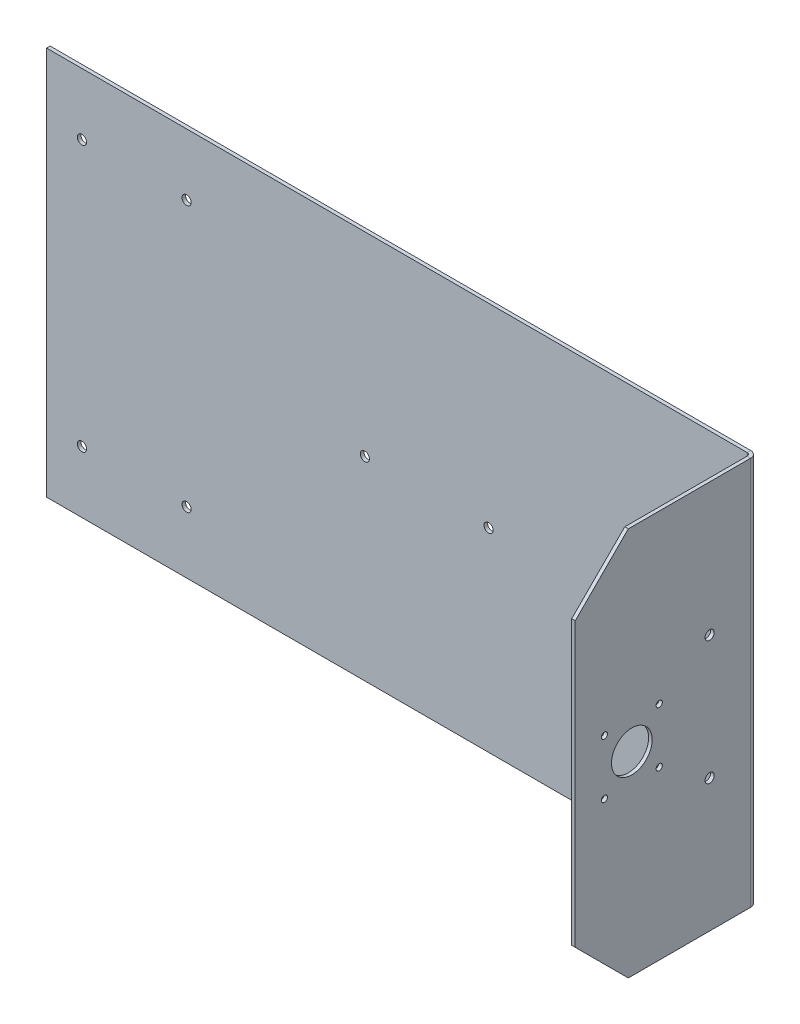
from build123d import *

# Parameters (mm, degrees)
SKETCH1_W            = 400
SKETCH1_H            = 220
BOSS_EXTRUDE1_DEPTH  = 3
SKETCH2_R            = 2.6
CUT_EXTRUDE1_DEPTH   = 90
SKETCH3_W            = 4
SKETCH3_H            = 220
BOSS_EXTRUDE2_DEPTH  = 90
SKETCH4_R            = 11.5
CUT_EXTRUDE2_DEPTH   = 90
SKETCH5_R            = 1.75
CUT_EXTRUDE3_DEPTH   = 90
SKETCH7_W            = 4
SKETCH7_H            = 220
BOSS_EXTRUDE3_DEPTH  = 10
CONVERT_SOLID2_START = -110
CONVERT_SOLID2_DEPTH = 220
CHAMFER1_SIZE        = 30
SKETCH6_R            = 2.6
CUT_EXTRUDE4_DEPTH   = 90


# Read off the part's stored shape, not the designer's step: Convert-Solid2
with BuildPart() as part:
    # Sketch1 → Boss-Extrude1 (new body)
    with BuildSketch(Plane.XY):
        Rectangle(SKETCH1_W, SKETCH1_H)
    extrude(amount=BOSS_EXTRUDE1_DEPTH)

    # Sketch2 → Cut-Extrude1 (cut)
    with BuildSketch(Plane(origin=(0, 0, 0), x_dir=(-1, 0, 0), z_dir=(0, 0, -1))):
        with Locations((-120, 0)):
            Circle(SKETCH2_R)
        with Locations((-50, 0)):
            Circle(SKETCH2_R)
        with Locations((20, 0)):
            Circle(SKETCH2_R)
        with Locations((120.81636457, -75.136060762)):
            Circle(SKETCH2_R)
        with Locations((120.81636457, 75.136060762)):
            Circle(SKETCH2_R)
        with Locations((180, 75.136060762)):
            Circle(SKETCH2_R)
        with Locations((180, -75.136060762)):
            Circle(SKETCH2_R)
    extrude(amount=-CUT_EXTRUDE1_DEPTH, mode=Mode.SUBTRACT)

    # Sketch3 → Boss-Extrude2 (add)
    with BuildSketch(Plane.XY.offset(3)):
        with Locations((198, 0)):
            Rectangle(SKETCH3_W, SKETCH3_H)
    extrude(amount=BOSS_EXTRUDE2_DEPTH)

    # Sketch4 → Cut-Extrude2 (cut)
    with BuildSketch(Plane(origin=(200, 0, 0), x_dir=(0, 0, -1), z_dir=(1, 0, 0))):
        with Locations(Location((-71, 0, 0), (0, 0, 90))):
            Circle(SKETCH4_R)
    extrude(amount=-CUT_EXTRUDE2_DEPTH, mode=Mode.SUBTRACT)

    # Sketch5 → Cut-Extrude3 (cut)
    with BuildSketch(Plane(origin=(200, 0, 0), x_dir=(0, 0, -1), z_dir=(1, 0, 0))):
        with Locations(Location((-55.5, 15.5, 0), (0, 0, 90))):
            Circle(SKETCH5_R)
        with Locations(Location((-55.5, -15.5, 0), (0, 0, 90))):
            Circle(SKETCH5_R)
        with Locations(Location((-86.5, -15.5, 0), (0, 0, 90))):
            Circle(SKETCH5_R)
        with Locations(Location((-86.5, 15.5, 0), (0, 0, 90))):
            Circle(SKETCH5_R)
    extrude(amount=-CUT_EXTRUDE3_DEPTH, mode=Mode.SUBTRACT)

    # Sketch7 → Boss-Extrude3 (add)
    with BuildSketch(Plane.XY.offset(93)):
        with Locations((198, 0)):
            Rectangle(SKETCH7_W, SKETCH7_H)
    extrude(amount=BOSS_EXTRUDE3_DEPTH)

    # Convert-Solid2 outline → Convert-Solid2 (cut)
    with BuildSketch(Plane(origin=(0, 0, 0), x_dir=(1, 0, 0), z_dir=(0, 1, 0)).offset(CONVERT_SOLID2_START)):
        with BuildLine():
            ThreePointArc((196.2, 0), (198.887005769, -1.112994231), (200, -3.8))
            Line((200, -3.8), (200, 0))
            Line((200, 0), (196.2, 0))
        make_face()
        with BuildLine():
            Line((196, -103), (198, -103))
            Line((198, -103), (198, -3.8))
            ThreePointArc((198, -3.8), (197.472792206, -2.527207794), (196.2, -2))
            Line((196.2, -2), (-200, -2))
            Line((-200, -2), (-200, -3))
            Line((-200, -3), (196, -3))
            Line((196, -3), (196, -103))
        make_face()
    extrude(amount=CONVERT_SOLID2_DEPTH, mode=Mode.SUBTRACT)

    # Chamfer1
    chamfer1_edges = [part.edges().sort_by_distance(p)[0] for p in [
        (199, -110, 103),
        (199, 110, 103),
    ]]
    chamfer(chamfer1_edges, length=CHAMFER1_SIZE)

    # Sketch6 → Cut-Extrude4 (cut)
    with BuildSketch(Plane(origin=(200, 0, 0), x_dir=(0, 0, -1), z_dir=(1, 0, 0))):
        with Locations(Location((-27, -35, 0), (0, 0, 90))):
            Circle(SKETCH6_R)
        with Locations(Location((-27, 35, 0), (0, 0, 90))):
            Circle(SKETCH6_R)
    extrude(amount=-CUT_EXTRUDE4_DEPTH, mode=Mode.SUBTRACT)


solid = part.part
